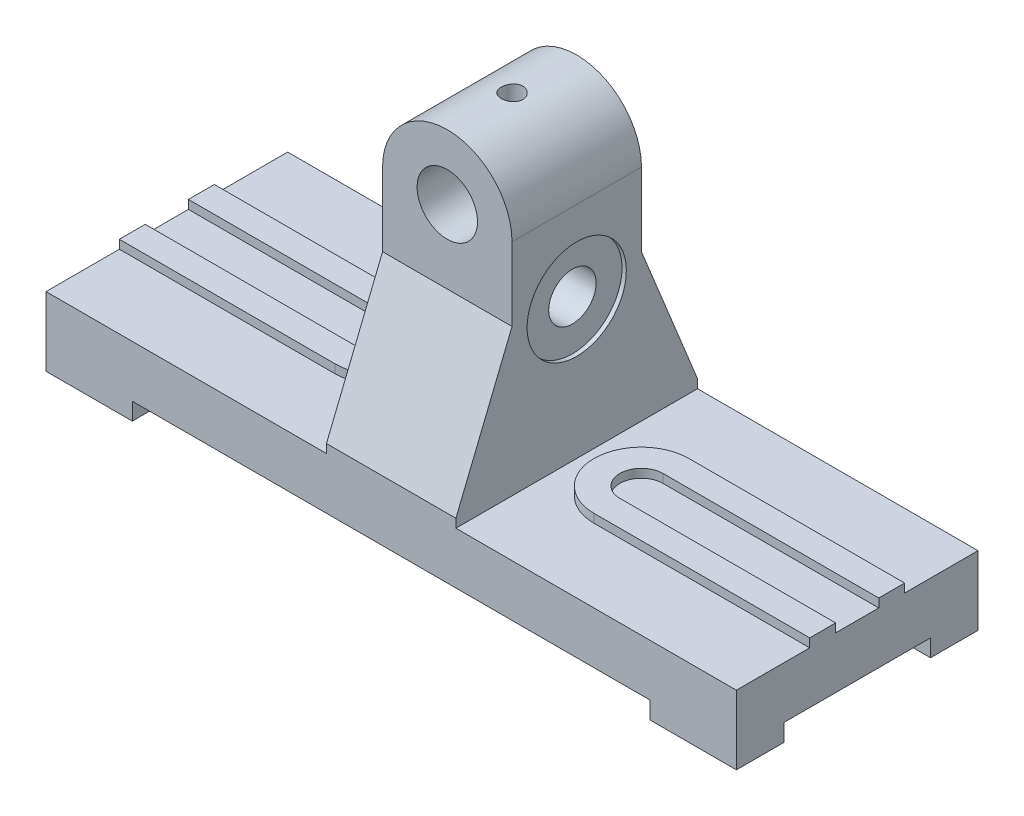
from build123d import *

# Parameters (mm, degrees)
SKETCH_1_W                  = 160
SKETCH_1_H                  = 56
EXTRUDE_1_DEPTH             = 16
SKETCH_2_W                  = 160
SKETCH_2_H                  = 34
CUT_EXTRUDE_1_DEPTH         = 4
SKETCH_3_W                  = 120
SKETCH_3_H                  = 56
CUT_EXTRUDE_2_DEPTH         = 4
EXTRUDE_2_DEPTH             = 2
EXTRUDE_3_DEPTH             = 15
CUT_EXTRUDE_START           = -30
CUT_EXTRUDE_3_DEPTH         = 30
HOLE_WIZARD_M16_1_D         = 14
HOLE_WIZARD_M6_1_REACH      = 119.932
HOLE_WIZARD_M6_1_BORE_R     = 2.5
HOLE_START                  = -15
HOLE_WIZARD_1_OUTLINE_R     = 5.5
HOLE_WIZARD_1_DEPTH         = 15
HOLE_WIZARD_1_2_OUTLINE_R   = 11.5
HOLE_WIZARD_1_2_OUTLINE_R_2 = 5.5
HOLE_WIZARD_1_2_DEPTH       = 1


# Read off the part's stored shape, not the designer's step: 切除-拉伸3, 孔1
with BuildPart() as part:
    # 草图1 → 凸台-拉伸1 (new body)
    with BuildSketch(Plane(origin=(0, 0, 0), x_dir=(1, 0, 0), z_dir=(0, 1, 0))):
        Rectangle(SKETCH_1_W, SKETCH_1_H)
    extrude(amount=EXTRUDE_1_DEPTH)

    # 草图2 → 切除-拉伸1 (cut)
    with BuildSketch(Plane.XZ):
        Rectangle(SKETCH_2_W, SKETCH_2_H)
    extrude(amount=-CUT_EXTRUDE_1_DEPTH, mode=Mode.SUBTRACT)

    # 草图3 → 切除-拉伸2 (cut)
    with BuildSketch(Plane.XZ):
        Rectangle(SKETCH_3_W, SKETCH_3_H)
    extrude(amount=-CUT_EXTRUDE_2_DEPTH, mode=Mode.SUBTRACT)

    # 草图4 → 凸台-拉伸2 (add)
    with BuildSketch(Plane(origin=(0, 16, 0), x_dir=(1, 0, 0), z_dir=(0, 1, 0))):
        with BuildLine():
            Line((-30, 11), (-80, 11))
            Line((-80, 11), (-80, 5))
            Line((-80, 5), (-30, 5))
            ThreePointArc((-30, 5), (-25, 0), (-30, -5))
            Line((-30, -5), (-80, -5))
            Line((-80, -5), (-80, -11))
            Line((-80, -11), (-30, -11))
            ThreePointArc((-30, -11), (-19, 0), (-30, 11))
        make_face()
    extrude_2 = extrude(amount=EXTRUDE_2_DEPTH)

    # 镜向1: 凸台-拉伸2 across plane
    add(extrude_2.mirror(Plane(origin=(0, 0, 0), x_dir=(0, 0, 1), z_dir=(1, 0, 0))))

    # 草图5 → 凸台-拉伸3 (add, symmetric)
    with BuildSketch(Plane(origin=(0, 0, 0), x_dir=(0, 0, -1), z_dir=(1, 0, 0))):
        Polygon((-28, 18), (-15, 50), (-15, 82), (15, 82), (15, 50), (28, 18), (28, 16), (-28, 16), align=None)
    extrude(amount=EXTRUDE_3_DEPTH, both=True)

    # 切除-拉伸3 outline → 切除-拉伸3 (cut)
    with BuildSketch(Plane.XY.offset(15).offset(CUT_EXTRUDE_START)):
        with BuildLine():
            Line((-15, 82), (-15, 67))
            ThreePointArc((-15, 67), (-10.606601718, 77.606601718), (0, 82))
            Line((0, 82), (-15, 82))
        make_face()
        with BuildLine():
            Line((15, 82), (0, 82))
            ThreePointArc((0, 82), (10.606601718, 77.606601718), (15, 67))
            Line((15, 67), (15, 82))
        make_face()
    extrude(amount=CUT_EXTRUDE_3_DEPTH, mode=Mode.SUBTRACT)

    # M16 螺纹孔1 (through all)
    with Locations(Plane.XY.offset(15)):
        with Locations((0, 67)):
            Hole(HOLE_WIZARD_M16_1_D / 2)

    # M6 螺纹孔1 bore → M6 螺纹孔1 (cut, up to next)
    with BuildSketch(Plane(origin=(0, 82, 0), x_dir=(1, 0, 0), z_dir=(0, 1, 0)), mode=Mode.PRIVATE) as hole_wizard_m6_1_sk1:
        Circle(HOLE_WIZARD_M6_1_BORE_R)
    hole_wizard_m6_1_tool1 = extrude(hole_wizard_m6_1_sk1.sketch, amount=-HOLE_WIZARD_M6_1_REACH, mode=Mode.PRIVATE) & part.part
    add(hole_wizard_m6_1_tool1.solids().sort_by_distance((0, 82, 0))[0], mode=Mode.SUBTRACT)

    # 孔1 outline → 孔1 (cut)
    with BuildSketch(Plane.YZ.offset(HOLE_START)):
        with Locations((48, 0)):
            Circle(HOLE_WIZARD_1_OUTLINE_R)
    hole_wizard_1 = extrude(amount=HOLE_WIZARD_1_DEPTH, mode=Mode.SUBTRACT)

    # Hole Wizard 1 2 outline → Hole Wizard 1 2 (cut)
    with BuildSketch(Plane.YZ.offset(HOLE_START)):
        with Locations((48, 0)):
            Circle(HOLE_WIZARD_1_2_OUTLINE_R)
        with Locations((48, 0)):
            Circle(HOLE_WIZARD_1_2_OUTLINE_R_2, mode=Mode.SUBTRACT)
    hole_wizard_1_2 = extrude(amount=HOLE_WIZARD_1_2_DEPTH, mode=Mode.SUBTRACT)

    # 镜向2: 孔1, Hole Wizard 1 2 across plane
    add(hole_wizard_1.mirror(Plane(origin=(0, 0, 0), x_dir=(0, 0, 1), z_dir=(1, 0, 0))), mode=Mode.SUBTRACT)
    add(hole_wizard_1_2.mirror(Plane(origin=(0, 0, 0), x_dir=(0, 0, 1), z_dir=(1, 0, 0))), mode=Mode.SUBTRACT)


solid = part.part
